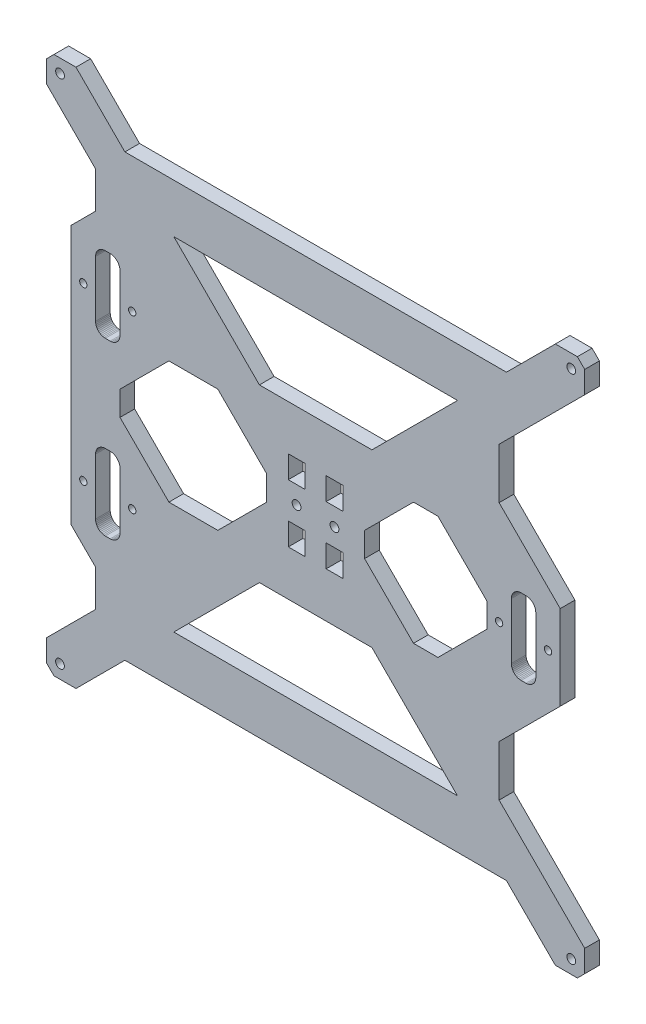
from build123d import *

# Parameters (mm, degrees)
MODEL_R                  = 1.8
MODEL_R_2                = 1.5
MODEL_W                  = 6.800001917
MODEL_H                  = 9.199997699
MODEL_H_2                = 9.1999977
MODEL_H_3                = 9.199995837
RESSALTO_EXTRUS_O1_DEPTH = 6


with BuildPart() as part:
    # Model → Ressalto-extrusão1 (new body)
    with BuildSketch(Plane.XY):
        Polygon((37.010811605, 11.085460693), (46.010809925, 11.085460693), (66.010802325, 31.085453093), (222.010752405, 31.085453094), (242.010744805, 11.085460693), (251.010743125, 11.085460693), (254.010742165, 14.085459733), (254.010742165, 23.085458053), (219.010754565, 58.085445654), (219.010754565, 78.811564901), (244.010745365, 103.811555701), (244.010745365, 138.388660741), (219.010754565, 163.388651541), (219.010754565, 184.085405334), (254.010742165, 219.085392934), (254.010742165, 228.085391254), (251.010743125, 231.085390294), (242.010744805, 231.085390294), (222.010752405, 211.085397894), (66.010802325, 211.085397894), (46.010809925, 231.085390294), (37.010811605, 231.085390294), (34.010812565, 228.085391254), (34.010812565, 219.085392934), (54.010806165, 199.085399334), (54.010806165, 184.085405334), (44.010809365, 174.085408534), (44.010809365, 68.085442453), (54.010806165, 58.085445653), (54.010806165, 43.085451653), (34.010812565, 23.085458053), (34.010812565, 14.085459733), align=None)
        with Locations((39.480299834, 16.593419865)):
            Circle(MODEL_R, mode=Mode.SUBTRACT)
        with Locations((49.010807765, 86.085436694)):
            Circle(MODEL_R_2, mode=Mode.SUBTRACT)
        Polygon((56.010805525, 101.54953336), (56.480071646, 101.780949801), (56.975529036, 101.949134922), (57.488700284, 102.05121103), (58.010804885, 102.085431574), (60.010804245, 102.085431574), (60.532908847, 102.05121103), (61.046080095, 101.949134922), (61.541537485, 101.780949801), (62.010803605, 101.54953336), (62.445849182, 101.258845199), (62.839230465, 100.913859073), (63.184216591, 100.52047779), (63.474904752, 100.085432214), (63.706321193, 99.616166093), (63.874506314, 99.120708703), (63.976582422, 98.607537455), (64.010802965, 98.085432854), (64.010802965, 75.085440213), (63.976582422, 74.563335612), (63.874506314, 74.050164364), (63.706321193, 73.554706974), (63.474904752, 73.085440853), (63.184216591, 72.650395277), (62.839230465, 72.257013994), (62.445849182, 71.912027868), (62.010803605, 71.621339707), (61.541537485, 71.389923266), (61.046080095, 71.221738145), (60.532908847, 71.119662037), (60.010804245, 71.085441493), (58.010804885, 71.085441493), (57.488700284, 71.119662037), (56.975529036, 71.221738145), (56.480071646, 71.389923266), (56.010805525, 71.621339707), (55.575759949, 71.912027868), (55.182378666, 72.257013994), (54.83739254, 72.650395277), (54.546704379, 73.085440853), (54.315287938, 73.554706974), (54.147102817, 74.050164364), (54.045026709, 74.563335612), (54.010806165, 75.085440213), (54.010806165, 98.085432854), (54.045026709, 98.607537455), (54.147102817, 99.120708703), (54.315287938, 99.616166093), (54.546704379, 100.085432214), (54.83739254, 100.52047779), (55.182378666, 100.913859073), (55.575759949, 101.258845199), align=None, mode=Mode.SUBTRACT)
        with Locations((69.010801365, 86.072658882)):
            Circle(MODEL_R_2, mode=Mode.SUBTRACT)
        Polygon((104.010790165, 146.085417494), (124.010783765, 126.085423894), (124.010783765, 116.085427094), (104.010790165, 96.085433494), (84.010796565, 96.085433494), (64.010802965, 116.085427094), (64.010802965, 126.085423894), (84.010796565, 146.085417494), align=None, mode=Mode.SUBTRACT)
        with Locations((136.2089217, 109.219016896)):
            Rectangle(MODEL_W, MODEL_H, mode=Mode.SUBTRACT)
        with Locations((248.521126181, 16.575076677)):
            Circle(MODEL_R, mode=Mode.SUBTRACT)
        Polygon((86.010798325, 51.085449093), (121.010785925, 86.085436694), (167.010768805, 86.085436694), (202.010756405, 51.085449093), align=None, mode=Mode.SUBTRACT)
        with Locations((151.706449048, 109.203945729)):
            Rectangle(MODEL_W, MODEL_H_2, mode=Mode.SUBTRACT)
        Polygon((204.081111687, 136.015067172), (214.010754965, 126.085423894), (214.010754965, 116.085427094), (204.081111687, 106.155783815), (194.010761365, 96.085433494), (184.010764565, 96.085433494), (164.010770965, 116.085427094), (164.010770965, 126.085423894), (184.010764565, 146.085417494), (194.010761365, 146.085417494), align=None, mode=Mode.SUBTRACT)
        Polygon((226.010751125, 135.412398917), (226.480017246, 135.643815358), (226.975474636, 135.812000479), (227.488645884, 135.914076587), (228.010750485, 135.94829713), (230.010749845, 135.94829713), (230.532854447, 135.914076587), (231.046025695, 135.812000479), (231.541483085, 135.643815358), (232.010749205, 135.412398917), (232.445794782, 135.121710756), (232.839176065, 134.77672463), (233.184162191, 134.383343347), (233.474850352, 133.94829777), (233.706266793, 133.47903165), (233.874451914, 132.983574259), (233.976528022, 132.470403012), (234.010748565, 131.94829841), (234.010748565, 108.94830577), (233.976528022, 108.426201168), (233.874451914, 107.913029921), (233.706266793, 107.417572531), (233.474850352, 106.94830641), (233.184162191, 106.513260833), (232.839176065, 106.119879551), (232.445794782, 105.774893425), (232.010749205, 105.484205264), (231.541483085, 105.252788823), (231.046025695, 105.084603702), (230.532854447, 104.982527594), (230.010749845, 104.94830705), (228.010750485, 104.94830705), (227.488645884, 104.982527594), (226.975474636, 105.084603702), (226.480017246, 105.252788823), (226.010751125, 105.484205264), (225.575705549, 105.774893425), (225.182324266, 106.119879551), (224.83733814, 106.513260833), (224.546649979, 106.94830641), (224.315233538, 107.417572531), (224.147048417, 107.913029921), (224.044972309, 108.426201168), (224.010751765, 108.94830577), (224.010751765, 131.94829841), (224.044972309, 132.470403012), (224.147048417, 132.983574259), (224.315233538, 133.47903165), (224.546649979, 133.94829777), (224.83733814, 134.383343347), (225.182324266, 134.77672463), (225.575705549, 135.121710756), align=None, mode=Mode.SUBTRACT)
        with Locations((49.010807765, 156.085414294)):
            Circle(MODEL_R_2, mode=Mode.SUBTRACT)
        Polygon((63.706321193, 169.623180587), (63.874506314, 169.127723196), (63.976582422, 168.614551949), (64.010802965, 168.092447347), (64.010802965, 145.092454707), (63.976582422, 144.570350105), (63.874506314, 144.057178858), (63.706321193, 143.561721468), (63.474904752, 143.092455347), (63.184216591, 142.65740977), (62.839230465, 142.264028488), (62.445849182, 141.919042362), (62.010803605, 141.628354201), (61.541537485, 141.39693776), (61.046080095, 141.228752639), (60.532908847, 141.126676531), (60.010804245, 141.092455987), (58.010804885, 141.092455987), (57.488700284, 141.126676531), (56.975529036, 141.228752639), (56.480071646, 141.39693776), (56.010805525, 141.628354201), (55.575759949, 141.919042362), (55.182378666, 142.264028488), (54.83739254, 142.65740977), (54.546704379, 143.092455347), (54.315287938, 143.561721468), (54.147102817, 144.057178858), (54.045026709, 144.570350105), (54.010806165, 145.092454707), (54.010806165, 168.092447347), (54.045026709, 168.614551949), (54.147102817, 169.127723196), (54.315287938, 169.623180587), (54.546704379, 170.092446707), (54.83739254, 170.527492284), (55.182378666, 170.920873567), (55.575759949, 171.265859693), (56.010805525, 171.556547854), (56.480071646, 171.787964295), (56.975529036, 171.956149416), (57.488700284, 172.058225524), (58.010804885, 172.092446067), (60.010804245, 172.092446067), (60.532908847, 172.058225524), (61.046080095, 171.956149416), (61.541537485, 171.787964295), (62.010803605, 171.556547854), (62.445849182, 171.265859693), (62.839230465, 170.920873567), (63.184216591, 170.527492284), (63.474904752, 170.092446707), align=None, mode=Mode.SUBTRACT)
        with Locations((69.010801365, 156.085414294)):
            Circle(MODEL_R_2, mode=Mode.SUBTRACT)
        with Locations((136.206939232, 121.134585997)):
            Circle(MODEL_R, mode=Mode.SUBTRACT)
        with Locations((136.2089217, 133.019007725)):
            Rectangle(MODEL_W, MODEL_H_3, mode=Mode.SUBTRACT)
        with Locations((39.500428549, 225.59577431)):
            Circle(MODEL_R, mode=Mode.SUBTRACT)
        with Locations((151.70446658, 121.119548169)):
            Circle(MODEL_R, mode=Mode.SUBTRACT)
        with Locations((151.706449048, 133.003936559)):
            Rectangle(MODEL_W, MODEL_H_3, mode=Mode.SUBTRACT)
        Polygon((121.010785925, 156.085414294), (86.010798325, 191.085401894), (202.010756405, 191.085401894), (167.010768805, 156.085414294), align=None, mode=Mode.SUBTRACT)
        with Locations((219.010753365, 121.115547183)):
            Circle(MODEL_R_2, mode=Mode.SUBTRACT)
        with Locations((239.010746965, 121.085425494)):
            Circle(MODEL_R_2, mode=Mode.SUBTRACT)
        with Locations((248.521126181, 225.59577431)):
            Circle(MODEL_R, mode=Mode.SUBTRACT)
    extrude(amount=RESSALTO_EXTRUS_O1_DEPTH)


solid = part.part
